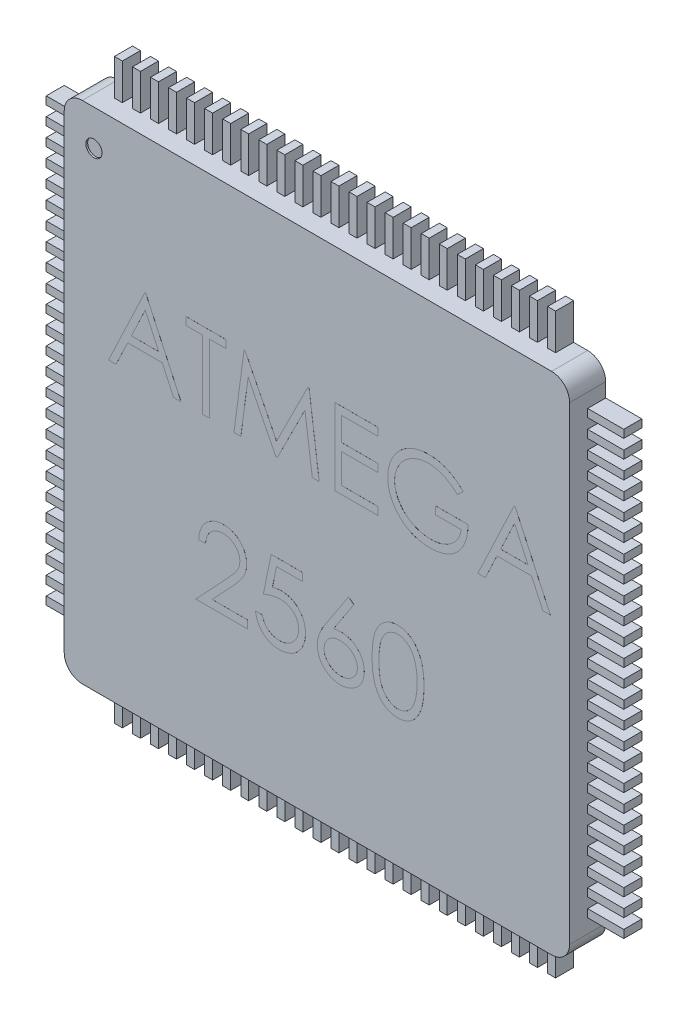
from build123d import *

# Parameters (mm, degrees)
BOSS_EXTRUDE1_DEPTH = 1
SKETCH3_W           = 1
SKETCH3_H           = 0.22
SKETCH3_W_2         = 0.22
SKETCH3_H_2         = 1
BOSS_EXTRUDE2_DEPTH = 0.5
BOSS_EXTRUDE3_DEPTH = 0.001
SKETCH5_R           = 0.223891774
CUT_EXTRUDE2_DEPTH  = 0.05


with BuildPart() as part:
    # Sketch1 → Boss-Extrude1 (new body)
    with BuildSketch(Plane.XY):
        with BuildLine():
            Line((6.5, 7), (-6.5, 7))
            ThreePointArc((-6.5, 7), (-6.853553391, 6.853553391), (-7, 6.5))
            Line((-7, 6.5), (-7, -6.5))
            ThreePointArc((-7, -6.5), (-6.853553391, -6.853553391), (-6.5, -7))
            Line((-6.5, -7), (6.5, -7))
            ThreePointArc((6.5, -7), (6.853553391, -6.853553391), (7, -6.5))
            Line((7, -6.5), (7, 6.5))
            ThreePointArc((7, 6.5), (6.853553391, 6.853553391), (6.5, 7))
        make_face()
    extrude(amount=BOSS_EXTRUDE1_DEPTH)

    # Sketch3 → Boss-Extrude2 (add)
    with BuildSketch(Plane.XY):
        with Locations((7.5, 0)):
            Rectangle(SKETCH3_W, SKETCH3_H)
        with Locations((7.5, 0.5)):
            Rectangle(SKETCH3_W, SKETCH3_H)
        with Locations((7.5, 1)):
            Rectangle(SKETCH3_W, SKETCH3_H)
        with Locations((7.5, 1.5)):
            Rectangle(SKETCH3_W, SKETCH3_H)
        with Locations((7.5, 2)):
            Rectangle(SKETCH3_W, SKETCH3_H)
        with Locations((7.5, 2.5)):
            Rectangle(SKETCH3_W, SKETCH3_H)
        with Locations((7.5, 3)):
            Rectangle(SKETCH3_W, SKETCH3_H)
        with Locations((7.5, 3.5)):
            Rectangle(SKETCH3_W, SKETCH3_H)
        with Locations((7.5, 4)):
            Rectangle(SKETCH3_W, SKETCH3_H)
        with Locations((7.5, 4.5)):
            Rectangle(SKETCH3_W, SKETCH3_H)
        with Locations((7.5, 5)):
            Rectangle(SKETCH3_W, SKETCH3_H)
        with Locations((7.5, 5.5)):
            Rectangle(SKETCH3_W, SKETCH3_H)
        with Locations((7.5, 6)):
            Rectangle(SKETCH3_W, SKETCH3_H)
        with Locations((7.5, -6)):
            Rectangle(SKETCH3_W, SKETCH3_H)
        with Locations((7.5, -5.5)):
            Rectangle(SKETCH3_W, SKETCH3_H)
        with Locations((7.5, -5)):
            Rectangle(SKETCH3_W, SKETCH3_H)
        with Locations((7.5, -4.5)):
            Rectangle(SKETCH3_W, SKETCH3_H)
        with Locations((7.5, -4)):
            Rectangle(SKETCH3_W, SKETCH3_H)
        with Locations((7.5, -3.5)):
            Rectangle(SKETCH3_W, SKETCH3_H)
        with Locations((7.5, -3)):
            Rectangle(SKETCH3_W, SKETCH3_H)
        with Locations((7.5, -2.5)):
            Rectangle(SKETCH3_W, SKETCH3_H)
        with Locations((7.5, -2)):
            Rectangle(SKETCH3_W, SKETCH3_H)
        with Locations((7.5, -1.5)):
            Rectangle(SKETCH3_W, SKETCH3_H)
        with Locations((7.5, -1)):
            Rectangle(SKETCH3_W, SKETCH3_H)
        with Locations((7.5, -0.5)):
            Rectangle(SKETCH3_W, SKETCH3_H)
        with Locations((-7.5, -0.5)):
            Rectangle(SKETCH3_W, SKETCH3_H)
        with Locations((-7.5, -1)):
            Rectangle(SKETCH3_W, SKETCH3_H)
        with Locations((-7.5, -1.5)):
            Rectangle(SKETCH3_W, SKETCH3_H)
        with Locations((-7.5, -2)):
            Rectangle(SKETCH3_W, SKETCH3_H)
        with Locations((-7.5, -2.5)):
            Rectangle(SKETCH3_W, SKETCH3_H)
        with Locations((-7.5, -3)):
            Rectangle(SKETCH3_W, SKETCH3_H)
        with Locations((-7.5, -3.5)):
            Rectangle(SKETCH3_W, SKETCH3_H)
        with Locations((-7.5, -4)):
            Rectangle(SKETCH3_W, SKETCH3_H)
        with Locations((-7.5, -4.5)):
            Rectangle(SKETCH3_W, SKETCH3_H)
        with Locations((-7.5, -5)):
            Rectangle(SKETCH3_W, SKETCH3_H)
        with Locations((-7.5, -5.5)):
            Rectangle(SKETCH3_W, SKETCH3_H)
        with Locations((-7.5, -6)):
            Rectangle(SKETCH3_W, SKETCH3_H)
        with Locations((-7.5, 6)):
            Rectangle(SKETCH3_W, SKETCH3_H)
        with Locations((-7.5, 5.5)):
            Rectangle(SKETCH3_W, SKETCH3_H)
        with Locations((-7.5, 5)):
            Rectangle(SKETCH3_W, SKETCH3_H)
        with Locations((-7.5, 4.5)):
            Rectangle(SKETCH3_W, SKETCH3_H)
        with Locations((-7.5, 4)):
            Rectangle(SKETCH3_W, SKETCH3_H)
        with Locations((-7.5, 3.5)):
            Rectangle(SKETCH3_W, SKETCH3_H)
        with Locations((-7.5, 3)):
            Rectangle(SKETCH3_W, SKETCH3_H)
        with Locations((-7.5, 2.5)):
            Rectangle(SKETCH3_W, SKETCH3_H)
        with Locations((-7.5, 2)):
            Rectangle(SKETCH3_W, SKETCH3_H)
        with Locations((-7.5, 1.5)):
            Rectangle(SKETCH3_W, SKETCH3_H)
        with Locations((-7.5, 1)):
            Rectangle(SKETCH3_W, SKETCH3_H)
        with Locations((-7.5, 0.5)):
            Rectangle(SKETCH3_W, SKETCH3_H)
        with Locations((-7.5, 0)):
            Rectangle(SKETCH3_W, SKETCH3_H)
        with Locations((0, 7.5)):
            Rectangle(SKETCH3_W_2, SKETCH3_H_2)
        with Locations((-0.5, 7.5)):
            Rectangle(SKETCH3_W_2, SKETCH3_H_2)
        with Locations((-1, 7.5)):
            Rectangle(SKETCH3_W_2, SKETCH3_H_2)
        with Locations((-1.5, 7.5)):
            Rectangle(SKETCH3_W_2, SKETCH3_H_2)
        with Locations((-2, 7.5)):
            Rectangle(SKETCH3_W_2, SKETCH3_H_2)
        with Locations((-2.5, 7.5)):
            Rectangle(SKETCH3_W_2, SKETCH3_H_2)
        with Locations((-3, 7.5)):
            Rectangle(SKETCH3_W_2, SKETCH3_H_2)
        with Locations((-3.5, 7.5)):
            Rectangle(SKETCH3_W_2, SKETCH3_H_2)
        with Locations((-4, 7.5)):
            Rectangle(SKETCH3_W_2, SKETCH3_H_2)
        with Locations((-4.5, 7.5)):
            Rectangle(SKETCH3_W_2, SKETCH3_H_2)
        with Locations((-5, 7.5)):
            Rectangle(SKETCH3_W_2, SKETCH3_H_2)
        with Locations((-5.5, 7.5)):
            Rectangle(SKETCH3_W_2, SKETCH3_H_2)
        with Locations((-6, 7.5)):
            Rectangle(SKETCH3_W_2, SKETCH3_H_2)
        with Locations((6, 7.5)):
            Rectangle(SKETCH3_W_2, SKETCH3_H_2)
        with Locations((5.5, 7.5)):
            Rectangle(SKETCH3_W_2, SKETCH3_H_2)
        with Locations((5, 7.5)):
            Rectangle(SKETCH3_W_2, SKETCH3_H_2)
        with Locations((4.5, 7.5)):
            Rectangle(SKETCH3_W_2, SKETCH3_H_2)
        with Locations((4, 7.5)):
            Rectangle(SKETCH3_W_2, SKETCH3_H_2)
        with Locations((3.5, 7.5)):
            Rectangle(SKETCH3_W_2, SKETCH3_H_2)
        with Locations((3, 7.5)):
            Rectangle(SKETCH3_W_2, SKETCH3_H_2)
        with Locations((2.5, 7.5)):
            Rectangle(SKETCH3_W_2, SKETCH3_H_2)
        with Locations((2, 7.5)):
            Rectangle(SKETCH3_W_2, SKETCH3_H_2)
        with Locations((1.5, 7.5)):
            Rectangle(SKETCH3_W_2, SKETCH3_H_2)
        with Locations((1, 7.5)):
            Rectangle(SKETCH3_W_2, SKETCH3_H_2)
        with Locations((0.5, 7.5)):
            Rectangle(SKETCH3_W_2, SKETCH3_H_2)
        with Locations((0.5, -7.5)):
            Rectangle(SKETCH3_W_2, SKETCH3_H_2)
        with Locations((1, -7.5)):
            Rectangle(SKETCH3_W_2, SKETCH3_H_2)
        with Locations((1.5, -7.5)):
            Rectangle(SKETCH3_W_2, SKETCH3_H_2)
        with Locations((2, -7.5)):
            Rectangle(SKETCH3_W_2, SKETCH3_H_2)
        with Locations((2.5, -7.5)):
            Rectangle(SKETCH3_W_2, SKETCH3_H_2)
        with Locations((3, -7.5)):
            Rectangle(SKETCH3_W_2, SKETCH3_H_2)
        with Locations((3.5, -7.5)):
            Rectangle(SKETCH3_W_2, SKETCH3_H_2)
        with Locations((4, -7.5)):
            Rectangle(SKETCH3_W_2, SKETCH3_H_2)
        with Locations((4.5, -7.5)):
            Rectangle(SKETCH3_W_2, SKETCH3_H_2)
        with Locations((5, -7.5)):
            Rectangle(SKETCH3_W_2, SKETCH3_H_2)
        with Locations((5.5, -7.5)):
            Rectangle(SKETCH3_W_2, SKETCH3_H_2)
        with Locations((6, -7.5)):
            Rectangle(SKETCH3_W_2, SKETCH3_H_2)
        with Locations((-6, -7.5)):
            Rectangle(SKETCH3_W_2, SKETCH3_H_2)
        with Locations((-5.5, -7.5)):
            Rectangle(SKETCH3_W_2, SKETCH3_H_2)
        with Locations((-5, -7.5)):
            Rectangle(SKETCH3_W_2, SKETCH3_H_2)
        with Locations((-4.5, -7.5)):
            Rectangle(SKETCH3_W_2, SKETCH3_H_2)
        with Locations((-4, -7.5)):
            Rectangle(SKETCH3_W_2, SKETCH3_H_2)
        with Locations((-3.5, -7.5)):
            Rectangle(SKETCH3_W_2, SKETCH3_H_2)
        with Locations((-3, -7.5)):
            Rectangle(SKETCH3_W_2, SKETCH3_H_2)
        with Locations((-2.5, -7.5)):
            Rectangle(SKETCH3_W_2, SKETCH3_H_2)
        with Locations((-2, -7.5)):
            Rectangle(SKETCH3_W_2, SKETCH3_H_2)
        with Locations((-1.5, -7.5)):
            Rectangle(SKETCH3_W_2, SKETCH3_H_2)
        with Locations((-1, -7.5)):
            Rectangle(SKETCH3_W_2, SKETCH3_H_2)
        with Locations((-0.5, -7.5)):
            Rectangle(SKETCH3_W_2, SKETCH3_H_2)
        with Locations((0, -7.5)):
            Rectangle(SKETCH3_W_2, SKETCH3_H_2)
    extrude(amount=BOSS_EXTRUDE2_DEPTH)

    # Sketch4 → Boss-Extrude3 (add)
    # profile 1 of 10: a face of its own
    with BuildSketch(Plane.XY.offset(1)):
        Polygon((-4.739964178, 3.253080773), (-3.763041101, 1.136414106), (-3.969534824, 1.136414106), (-4.282455497, 1.81483291), (-5.241994092, 1.81483291), (-5.563819012, 1.136414106), (-5.771160759, 1.136414106), (-4.76710093, 3.253080773), align=None)
        Polygon((-4.755652613, 2.840517338), (-5.138959237, 2.031926927), (-4.382522271, 2.031926927), align=None, mode=Mode.SUBTRACT)
    # profile 2 of 10: a face of its own
    with BuildSketch(Plane.XY.offset(1)):
        Polygon((-3.62735734, 3.035986756), (-3.62735734, 3.253080773), (-2.514750503, 3.253080773), (-2.514750503, 3.035986756), (-2.976075289, 3.035986756), (-2.976075289, 1.136414106), (-3.166032554, 1.136414106), (-3.166032554, 3.035986756), align=None)
    # profile 3 of 10: a face of its own
    with BuildSketch(Plane.XY.offset(1)):
        Polygon((-2.297656485, 1.136414106), (-2.018232741, 3.253080773), (-1.991095989, 3.253080773), (-1.117207768, 1.516328636), (-0.245439605, 3.253080773), (-0.217878841, 3.253080773), (0.06324095, 1.136414106), (-0.127564338, 1.136414106), (-0.330241956, 2.65946432), (-1.094311133, 1.136414106), (-1.13713632, 1.136414106), (-1.904173579, 2.662856414), (-2.106427185, 1.136414106), align=None)
    # profile 4 of 10: a face of its own
    with BuildSketch(Plane.XY.offset(1)):
        Polygon((0.497428985, 3.253080773), (1.691446079, 3.253080773), (1.691446079, 3.035986756), (0.68738625, 3.035986756), (0.68738625, 2.384704705), (1.691446079, 2.384704705), (1.691446079, 2.167610688), (0.68738625, 2.167610688), (0.68738625, 1.353508123), (1.691446079, 1.353508123), (1.691446079, 1.136414106), (0.497428985, 1.136414106), align=None)
    # profile 5 of 10: a face of its own
    with BuildSketch(Plane.XY.offset(1)):
        with BuildLine():
            Line((4.052343515, 2.89182276), (3.889523002, 2.737482482))
            add(Edge.make_bspline(
                [(3.889523002, 2.737482482), (3.860059674, 2.765199242), (3.801835589, 2.81997184), (3.706912014, 2.891038014), (3.607874006, 2.951917036), (3.505238353, 3.001450808), (3.401546752, 3.040973668), (3.298175539, 3.069112114), (3.196185044, 3.087056935), (3.128350583, 3.089202853), (3.094924978, 3.09026026)],
                knots=[0, 0, 0, 0, 1.08915593, 2.152340314, 3.188132944, 4.216796309, 5.218260357, 6.173443236, 7.099959455, 8, 8, 8, 8], degree=3))
            add(Edge.make_bspline(
                [(3.094924978, 3.09026026), (3.07441466, 3.090010127), (3.033447217, 3.08951051), (2.972594898, 3.08313377), (2.912380789, 3.073962638), (2.852918558, 3.060693026), (2.79409259, 3.043875166), (2.736107479, 3.022838243), (2.678855059, 2.998311977), (2.62287462, 2.969971338), (2.568602982, 2.938838288), (2.517345277, 2.904337504), (2.468774793, 2.867574759), (2.42380444, 2.827629643), (2.382175541, 2.784863986), (2.34289724, 2.74007332), (2.307350971, 2.692033926), (2.275243457, 2.641629667), (2.246600954, 2.589745819), (2.221316673, 2.536881773), (2.200091292, 2.48321287), (2.183297383, 2.428671766), (2.169441892, 2.37368041), (2.159694577, 2.317858031), (2.154199274, 2.261144859), (2.153248721, 2.22316747), (2.152770865, 2.204075698)],
                knots=[0, 0, 0, 0, 1.02818874, 2.053710826, 3.065248034, 4.081641283, 5.106893873, 6.131558223, 7.173050175, 8.228653731, 9.27666206, 10.308777013, 11.325269123, 12.329503258, 13.32196095, 14.316845687, 15.314881793, 16.315733098, 17.311955233, 18.285320748, 19.252783886, 20.203351036, 21.145449891, 22.095197417, 23.042428769, 24, 24, 24, 24], degree=3))
            add(Edge.make_bspline(
                [(2.152770865, 2.204075698), (2.153227895, 2.184559537), (2.154140706, 2.145580508), (2.159982899, 2.087405997), (2.170825216, 2.030095492), (2.185319973, 1.973460669), (2.203451228, 1.917404533), (2.226052793, 1.86217011), (2.252822942, 1.807759445), (2.283808857, 1.754662791), (2.317788132, 1.702941725), (2.35585371, 1.654222395), (2.396288444, 1.607856039), (2.440565421, 1.564872125), (2.487264859, 1.524120911), (2.537781997, 1.486725143), (2.591123485, 1.451964503), (2.647370704, 1.420277084), (2.705913339, 1.391969065), (2.765940042, 1.366796519), (2.827642578, 1.346065681), (2.890696681, 1.32916978), (2.955027183, 1.315320553), (3.020960626, 1.30641091), (3.088012216, 1.299945503), (3.133211293, 1.299472778), (3.155982671, 1.299234619)],
                knots=[0, 0, 0, 0, 0.93586088, 1.869166235, 2.799637598, 3.729985548, 4.670839027, 5.622275134, 6.589130586, 7.576015415, 8.568469353, 9.55398029, 10.53834874, 11.515998671, 12.510579167, 13.508179873, 14.527009472, 15.561807829, 16.601455013, 17.643573243, 18.680854198, 19.719860599, 20.772568776, 21.833555941, 22.908541556, 24, 24, 24, 24], degree=3))
            add(Edge.make_bspline(
                [(3.155982671, 1.299234619), (3.183425766, 1.299808282), (3.237314743, 1.300934762), (3.316530354, 1.309703985), (3.392611259, 1.323399903), (3.465343677, 1.343457374), (3.534812084, 1.369041025), (3.601271149, 1.399881092), (3.664197628, 1.437160466), (3.72378069, 1.47923609), (3.778667179, 1.526114108), (3.828169435, 1.576699088), (3.871497897, 1.63074549), (3.909298358, 1.68793499), (3.940569783, 1.74874096), (3.966237568, 1.812865415), (3.985912464, 1.880337196), (3.993989044, 1.926959278), (3.99807001, 1.95051667)],
                knots=[0, 0, 0, 0, 1.13008108, 2.219097802, 3.278683437, 4.311054135, 5.322181354, 6.324827112, 7.324222904, 8.330512327, 9.32562643, 10.293043162, 11.24128371, 12.174520618, 13.111833804, 14.052305215, 15.015860969, 16, 16, 16, 16], degree=3))
            Line((3.99807001, 1.95051667), (3.292514455, 1.95051667))
            Line((3.292514455, 1.95051667), (3.292514455, 2.167610688))
            Line((3.292514455, 2.167610688), (4.188027275, 2.167610688))
            add(Edge.make_bspline(
                [(4.188027275, 2.167610688), (4.186995643, 2.127147587), (4.184976553, 2.04795399), (4.170813685, 1.932462446), (4.147943699, 1.823380517), (4.11670151, 1.720593326), (4.076257888, 1.624246534), (4.027046883, 1.53424232), (3.968280886, 1.451162137), (3.902053143, 1.374327739), (3.82772793, 1.305790549), (3.747313574, 1.245552672), (3.660677217, 1.194811567), (3.56790081, 1.153530119), (3.469288071, 1.121312036), (3.364610813, 1.098469225), (3.254010988, 1.084783486), (3.178212141, 1.083034889), (3.139446212, 1.082140602)],
                knots=[0, 0, 0, 0, 1.140356446, 2.231883559, 3.274166699, 4.278491846, 5.25512956, 6.21435461, 7.1637429, 8.11826594, 9.068280886, 10.0076534, 10.945064095, 11.891975133, 12.864533718, 13.863980011, 14.907571808, 16, 16, 16, 16], degree=3))
            add(Edge.make_bspline(
                [(3.139446212, 1.082140602), (3.115551987, 1.082484785), (3.068424875, 1.083163624), (2.998822266, 1.08798802), (2.931138753, 1.095414845), (2.865384195, 1.106630229), (2.801316722, 1.120367187), (2.739256306, 1.137957726), (2.678966538, 1.158319273), (2.620354233, 1.181479037), (2.563951388, 1.208313325), (2.50950678, 1.238133916), (2.456719456, 1.270787044), (2.40594899, 1.306837413), (2.356930847, 1.346015377), (2.309981098, 1.388399461), (2.264836905, 1.433860091), (2.236557958, 1.466141682), (2.222308792, 1.482407696)],
                knots=[0, 0, 0, 0, 1.107784379, 2.184907829, 3.233506516, 4.263428166, 5.276301166, 6.270063455, 7.25232949, 8.225834625, 9.190232166, 10.146266622, 11.1027726, 12.066435141, 13.031522626, 14.010570082, 14.99756817, 16, 16, 16, 16], degree=3))
            add(Edge.make_bspline(
                [(2.222308792, 1.482407696), (2.201634443, 1.508213281), (2.160628917, 1.559396106), (2.107846413, 1.641401787), (2.062851279, 1.726311483), (2.02634312, 1.814361568), (1.997835801, 1.905469682), (1.977391067, 1.999519406), (1.965412373, 2.096631849), (1.963686662, 2.162348462), (1.9628136, 2.195595463)],
                knots=[0, 0, 0, 0, 1.023165419, 2.029347347, 3.013907458, 3.994755782, 4.975994455, 5.96558838, 6.970761222, 8, 8, 8, 8], degree=3))
            add(Edge.make_bspline(
                [(1.9628136, 2.195595463), (1.963135477, 2.220491245), (1.963775141, 2.269966397), (1.971531525, 2.34341915), (1.982660001, 2.415567664), (1.99901703, 2.486352962), (2.019637152, 2.55582232), (2.045371879, 2.624007993), (2.075334745, 2.69095022), (2.110160259, 2.756188226), (2.148916099, 2.818856323), (2.190977422, 2.878702233), (2.236941504, 2.934636096), (2.286057726, 2.987366283), (2.338912096, 3.036230348), (2.395009462, 3.081680691), (2.454393055, 3.12377828), (2.517249697, 3.161860037), (2.582641202, 3.19606756), (2.650410822, 3.226057226), (2.72053787, 3.250842374), (2.792496963, 3.271872231), (2.866832785, 3.287423768), (2.943005896, 3.298701819), (3.021413344, 3.306418944), (3.074412276, 3.307039584), (3.101285155, 3.307354277)],
                knots=[0, 0, 0, 0, 1.008945113, 2.00506715, 2.99143336, 3.967273523, 4.948097931, 5.927297278, 6.919902385, 7.919676788, 8.923139349, 9.905703106, 10.883022732, 11.856032218, 12.825136022, 13.798837087, 14.781400844, 15.773989409, 16.776158564, 17.77167057, 18.775803737, 19.789618931, 20.80898985, 21.851988756, 22.910860228, 24, 24, 24, 24], degree=3))
            add(Edge.make_bspline(
                [(3.101285155, 3.307354277), (3.123200664, 3.307003823), (3.166656543, 3.306308913), (3.231321153, 3.301492197), (3.294986262, 3.293857754), (3.357746269, 3.28343965), (3.419387452, 3.269249704), (3.480085412, 3.252269027), (3.539928137, 3.232498258), (3.598728078, 3.208919289), (3.656880601, 3.182156383), (3.714709048, 3.152031123), (3.77201583, 3.118028382), (3.828900328, 3.080047196), (3.885721252, 3.038739891), (3.941579869, 2.99292505), (3.997824506, 2.944409383), (4.033990365, 2.909525396), (4.052343515, 2.89182276)],
                knots=[0, 0, 0, 0, 0.985871117, 1.954866573, 2.915460327, 3.869826059, 4.81536089, 5.759505086, 6.70452669, 7.649098992, 8.607881297, 9.583363685, 10.581137262, 11.603961102, 12.659522466, 13.73993555, 14.853081303, 16, 16, 16, 16], degree=3))
        make_face()
    # profile 6 of 10: a face of its own
    with BuildSketch(Plane.XY.offset(1)):
        Polygon((5.490591378, 3.253080773), (6.467514455, 1.136414106), (6.261020731, 1.136414106), (5.948100058, 1.81483291), (4.988561463, 1.81483291), (4.666736543, 1.136414106), (4.459394797, 1.136414106), (5.463454626, 3.253080773), align=None)
        Polygon((5.474902943, 2.840517338), (5.091596319, 2.031926927), (5.848033285, 2.031926927), align=None, mode=Mode.SUBTRACT)
    # profile 7 of 10: a face of its own
    with BuildSketch(Plane.XY.offset(1)):
        with BuildLine():
            Line((-3.084622297, -1.925979056), (-3.274579562, -1.925979056))
            add(Edge.make_bspline(
                [(-3.274579562, -1.925979056), (-3.273341522, -1.900778091), (-3.270910044, -1.851284065), (-3.259523412, -1.779121512), (-3.243230596, -1.710145515), (-3.220194336, -1.6449099), (-3.191585301, -1.58283786), (-3.157277142, -1.524175945), (-3.116640861, -1.469147941), (-3.070553931, -1.418263974), (-3.020498611, -1.371583871), (-2.966489781, -1.33127332), (-2.909735884, -1.297214538), (-2.850409104, -1.268741596), (-2.787840097, -1.247369404), (-2.722596654, -1.231511555), (-2.654392129, -1.221970622), (-2.607922211, -1.220945075), (-2.58428843, -1.220423501)],
                knots=[0, 0, 0, 0, 1.10065271, 2.161652631, 3.183658789, 4.190468796, 5.17591951, 6.163126047, 7.15150782, 8.156236427, 9.156009102, 10.134482811, 11.092018607, 12.041330605, 13.001268258, 13.972401359, 14.968799086, 16, 16, 16, 16], degree=3))
            add(Edge.make_bspline(
                [(-2.58428843, -1.220423501), (-2.561078833, -1.220966853), (-2.515472803, -1.22203452), (-2.44891149, -1.231203333), (-2.385546174, -1.245563763), (-2.325500715, -1.265711657), (-2.26925419, -1.292795573), (-2.216384063, -1.325330275), (-2.166260906, -1.362958459), (-2.121141566, -1.407259574), (-2.079710489, -1.454553397), (-2.043967697, -1.505043701), (-2.013358784, -1.557191888), (-1.987845282, -1.61139561), (-1.969063712, -1.668165232), (-1.95480451, -1.726674254), (-1.946744598, -1.787528307), (-1.945507604, -1.828716557), (-1.944878708, -1.849656941)],
                knots=[0, 0, 0, 0, 1.111607364, 2.184268762, 3.212621178, 4.221274766, 5.211760367, 6.196651075, 7.1921475, 8.207485113, 9.220403448, 10.201281604, 11.166441695, 12.114753415, 13.065576456, 14.026450734, 14.996634279, 16, 16, 16, 16], degree=3))
            add(Edge.make_bspline(
                [(-1.944878708, -1.849656941), (-1.945902729, -1.879137774), (-1.9479328, -1.937582094), (-1.965298161, -2.023467273), (-1.992419623, -2.106678531), (-2.025075167, -2.173648233), (-2.058018026, -2.22761325), (-2.087704281, -2.272044324), (-2.122456809, -2.319884298), (-2.162781425, -2.370972973), (-2.207843971, -2.425710521), (-2.258052613, -2.484063873), (-2.313765385, -2.545430134), (-2.352868383, -2.587343521), (-2.373130577, -2.609061989)],
                knots=[0, 0, 0, 0, 1.184426356, 2.348067706, 3.509069118, 4.696110526, 5.333549288, 6.050745305, 6.844228056, 7.710549037, 8.667450064, 9.695053472, 10.805634456, 12, 12, 12, 12], degree=3))
            Line((-2.373130577, -2.609061989), (-2.902721256, -3.174269654))
            Line((-2.902721256, -3.174269654), (-1.917741956, -3.174269654))
            Line((-1.917741956, -3.174269654), (-1.917741956, -3.391363671))
            Line((-1.917741956, -3.391363671), (-3.355989819, -3.391363671))
            Line((-3.355989819, -3.391363671), (-2.535103067, -2.515355392))
            add(Edge.make_bspline(
                [(-2.535103067, -2.515355392), (-2.515116964, -2.49449213), (-2.47672775, -2.454418074), (-2.422430668, -2.395911617), (-2.37366328, -2.341634514), (-2.330109904, -2.291689316), (-2.292715356, -2.245345463), (-2.25953072, -2.204103904), (-2.232942006, -2.166152403), (-2.204085552, -2.122161651), (-2.176137097, -2.068451345), (-2.152120577, -2.002814304), (-2.137476359, -1.935245918), (-2.135719625, -1.889585162), (-2.134835973, -1.866617411)],
                knots=[0, 0, 0, 0, 1.329631726, 2.553950428, 3.673215718, 4.687767853, 5.603093632, 6.413772471, 7.123043292, 7.734684054, 8.834405432, 9.900288307, 10.943827018, 12, 12, 12, 12], degree=3))
            add(Edge.make_bspline(
                [(-2.134835973, -1.866617411), (-2.135220445, -1.852174851), (-2.135978167, -1.823711338), (-2.142665441, -1.781979284), (-2.152771319, -1.741723421), (-2.167252499, -1.702819922), (-2.186367051, -1.665659933), (-2.209634286, -1.630198219), (-2.236479705, -1.595914892), (-2.267534996, -1.563769802), (-2.301650535, -1.534329264), (-2.337690867, -1.50824946), (-2.375821168, -1.486454378), (-2.41588067, -1.468587597), (-2.457757692, -1.454572009), (-2.501533228, -1.444860392), (-2.547086324, -1.43876289), (-2.578191343, -1.437937891), (-2.5940407, -1.437517518)],
                knots=[0, 0, 0, 0, 0.991446411, 1.95395049, 2.89581595, 3.838931463, 4.798493298, 5.75982156, 6.748411868, 7.785213223, 8.824556874, 9.840280684, 10.836137867, 11.835679398, 12.848801643, 13.863922112, 14.911575587, 16, 16, 16, 16], degree=3))
            add(Edge.make_bspline(
                [(-2.5940407, -1.437517518), (-2.610593537, -1.437949942), (-2.643100576, -1.438799152), (-2.6908278, -1.444739525), (-2.736357771, -1.454987723), (-2.779805017, -1.469004093), (-2.821243052, -1.486819501), (-2.860470355, -1.509009271), (-2.897398864, -1.535487859), (-2.932098, -1.565508577), (-2.96406812, -1.598932317), (-2.992157421, -1.636191675), (-3.016701087, -1.67660635), (-3.038115243, -1.720067293), (-3.055505588, -1.766968864), (-3.068794113, -1.817144572), (-3.079309015, -1.87037655), (-3.082821787, -1.907137054), (-3.084622297, -1.925979056)],
                knots=[0, 0, 0, 0, 1.031018746, 2.02475058, 2.990194455, 3.934040569, 4.864654155, 5.795059489, 6.735614925, 7.690564532, 8.649604399, 9.611025574, 10.590972636, 11.591080095, 12.624614302, 13.701020113, 14.821632451, 16, 16, 16, 16], degree=3))
        make_face()
    # profile 8 of 10: a face of its own
    with BuildSketch(Plane.XY.offset(1)):
        with BuildLine():
            Line((-0.398083836, -1.274697005), (-0.398083836, -1.491791022))
            Line((-0.398083836, -1.491791022), (-1.118055791, -1.491791022))
            Line((-1.118055791, -1.491791022), (-1.232114952, -2.048518452))
            add(Edge.make_bspline(
                [(-1.232114952, -2.048518452), (-1.209704971, -2.042331574), (-1.166289177, -2.030345475), (-1.10220869, -2.017037223), (-1.041374357, -2.009014788), (-1.0018983, -2.007919376), (-0.982796042, -2.007389312)],
                knots=[0, 0, 0, 0, 1.100273476, 2.13160584, 3.095893838, 4, 4, 4, 4], degree=3))
            add(Edge.make_bspline(
                [(-0.982796042, -2.007389312), (-0.959159685, -2.007900902), (-0.912684702, -2.008906815), (-0.84468591, -2.018565981), (-0.779775065, -2.033769644), (-0.718087918, -2.055009198), (-0.659510347, -2.082168893), (-0.604581297, -2.116096), (-0.552476274, -2.155728062), (-0.504130039, -2.201293855), (-0.4602701, -2.25144169), (-0.421706858, -2.305360974), (-0.388951387, -2.362527703), (-0.362607502, -2.423488071), (-0.341571262, -2.487568131), (-0.327569817, -2.555442121), (-0.318246379, -2.62647027), (-0.317204745, -2.675035415), (-0.316673579, -2.699800504)],
                knots=[0, 0, 0, 0, 1.052922333, 2.070308379, 3.05430497, 4.020497103, 4.973039431, 5.925935799, 6.892292201, 7.88610001, 8.88166317, 9.857072816, 10.836096531, 11.812156883, 12.81219415, 13.836441305, 14.89672472, 16, 16, 16, 16], degree=3))
            add(Edge.make_bspline(
                [(-0.316673579, -2.699800504), (-0.317075792, -2.717049656), (-0.31787478, -2.751314853), (-0.321937926, -2.80220206), (-0.329760955, -2.852011964), (-0.340264293, -2.900751173), (-0.353897088, -2.948327412), (-0.370400468, -2.99487686), (-0.390597114, -3.040109789), (-0.412750374, -3.084454194), (-0.437694672, -3.126907577), (-0.46537977, -3.166609583), (-0.494629376, -3.204155792), (-0.526102024, -3.239143525), (-0.560090245, -3.271342874), (-0.596182415, -3.30094493), (-0.634090536, -3.328450306), (-0.674401087, -3.3527425), (-0.716215827, -3.375096288), (-0.760138606, -3.393434808), (-0.805169601, -3.409830223), (-0.85195693, -3.422898842), (-0.900394617, -3.433139006), (-0.950562505, -3.440094131), (-1.002197481, -3.445159881), (-1.037198084, -3.445476992), (-1.05487804, -3.445637176)],
                knots=[0, 0, 0, 0, 1.056347294, 2.098418968, 3.122841568, 4.141288669, 5.149314143, 6.15115421, 7.162517403, 8.180376062, 9.185164535, 10.17417709, 11.141909838, 12.097768115, 13.052685741, 14.0056014, 14.954263652, 15.917497458, 16.885230207, 17.854509472, 18.828990115, 19.81800267, 20.826176721, 21.857883937, 22.917946725, 24, 24, 24, 24], degree=3))
            add(Edge.make_bspline(
                [(-1.05487804, -3.445637176), (-1.075968616, -3.445219383), (-1.117461833, -3.444397426), (-1.178252842, -3.435798628), (-1.236742151, -3.423483307), (-1.292458927, -3.404955658), (-1.345902501, -3.381740484), (-1.396353382, -3.352399752), (-1.445100685, -3.319150485), (-1.490162726, -3.279913319), (-1.531985709, -3.237026216), (-1.569424407, -3.190485166), (-1.602767094, -3.141058313), (-1.631479827, -3.08850562), (-1.655971487, -3.032965175), (-1.67521198, -2.974228884), (-1.690741271, -2.912603644), (-1.697311054, -2.870177473), (-1.700647938, -2.848628629)],
                knots=[0, 0, 0, 0, 1.0467383, 2.05933395, 3.04377827, 4.011590433, 4.970194871, 5.932262533, 6.905835911, 7.896367577, 8.894135286, 9.877477877, 10.858688626, 11.851381753, 12.8477658, 13.868841284, 14.917554742, 16, 16, 16, 16], degree=3))
            Line((-1.700647938, -2.848628629), (-1.510690673, -2.848628629))
            add(Edge.make_bspline(
                [(-1.510690673, -2.848628629), (-1.506016736, -2.868813436), (-1.49703317, -2.907609755), (-1.477314455, -2.962117757), (-1.453205092, -3.010691764), (-1.424536748, -3.053974321), (-1.390337444, -3.091716905), (-1.351312504, -3.125351986), (-1.307559357, -3.155695992), (-1.258940594, -3.180988809), (-1.207648875, -3.202559912), (-1.153965848, -3.216924032), (-1.099353219, -3.227024096), (-1.062415348, -3.228035113), (-1.043853734, -3.228543159)],
                knots=[0, 0, 0, 0, 1.136247022, 2.183929868, 3.172523383, 4.106158343, 5.02341133, 5.958108904, 6.928429099, 7.938127109, 8.96079061, 9.975095812, 10.982467395, 12, 12, 12, 12], degree=3))
            add(Edge.make_bspline(
                [(-1.043853734, -3.228543159), (-1.025736008, -3.228046783), (-0.990062058, -3.227069417), (-0.937561838, -3.219546776), (-0.886875005, -3.207961007), (-0.838501699, -3.190622571), (-0.791595434, -3.169549812), (-0.747342725, -3.142507838), (-0.704463366, -3.111386779), (-0.664290162, -3.075732055), (-0.627496781, -3.036440859), (-0.594987126, -2.994423578), (-0.567907755, -2.949600533), (-0.545087603, -2.902747721), (-0.52775918, -2.853351641), (-0.515397253, -2.801643788), (-0.50813826, -2.747496443), (-0.50713969, -2.710564051), (-0.506630844, -2.69174428)],
                knots=[0, 0, 0, 0, 1.027316725, 2.022795036, 3.002884548, 3.971462791, 4.93288096, 5.914575861, 6.907176829, 7.935150275, 8.956128384, 9.956726525, 10.942570165, 11.921478529, 12.907843606, 13.90538589, 14.932640048, 16, 16, 16, 16], degree=3))
            add(Edge.make_bspline(
                [(-0.506630844, -2.69174428), (-0.507029068, -2.674765135), (-0.507808533, -2.641530875), (-0.514177021, -2.592908498), (-0.525254428, -2.54690242), (-0.540629822, -2.503290478), (-0.560151239, -2.462031539), (-0.584006866, -2.423083022), (-0.612644397, -2.386958275), (-0.64535711, -2.353640397), (-0.681194116, -2.322891354), (-0.720771998, -2.296678502), (-0.763262526, -2.274626514), (-0.80815376, -2.255595867), (-0.856513484, -2.241927797), (-0.907384019, -2.231666266), (-0.961314695, -2.225730309), (-0.998187444, -2.224906691), (-1.017140994, -2.22448333)],
                knots=[0, 0, 0, 0, 1.045622112, 2.046656509, 3.013763289, 3.955457236, 4.890082067, 5.820317437, 6.762574623, 7.722996705, 8.69280354, 9.665887285, 10.63943826, 11.638615906, 12.663482002, 13.728887084, 14.832589034, 16, 16, 16, 16], degree=3))
            add(Edge.make_bspline(
                [(-1.017140994, -2.22448333), (-1.033547537, -2.224834449), (-1.067422885, -2.225559421), (-1.119385737, -2.230897351), (-1.173990732, -2.239508733), (-1.231028546, -2.25135375), (-1.290670472, -2.266854448), (-1.352790648, -2.285429408), (-1.417519685, -2.307637474), (-1.461133737, -2.324408861), (-1.483553921, -2.333030338)],
                knots=[0, 0, 0, 0, 0.817624296, 1.688186739, 2.600797293, 3.572016777, 4.590301741, 5.671205678, 6.80286297, 8, 8, 8, 8], degree=3))
            Line((-1.483553921, -2.333030338), (-1.266459904, -1.274697005))
            Line((-1.266459904, -1.274697005), (-0.398083836, -1.274697005))
        make_face()
    # profile 9 of 10: a face of its own
    with BuildSketch(Plane.XY.offset(1)):
        with BuildLine():
            Line((0.877343515, -1.220423501), (1.023627569, -1.335330685))
            Line((1.023627569, -1.335330685), (0.464356068, -2.190562389))
            add(Edge.make_bspline(
                [(0.464356068, -2.190562389), (0.501591426, -2.18462734), (0.574223202, -2.173050356), (0.647741626, -2.171140551), (0.683570144, -2.170209825)],
                knots=[0, 0, 0, 0, 1.025318673, 2, 2, 2, 2], degree=3))
            add(Edge.make_bspline(
                [(0.683570144, -2.170209825), (0.705083034, -2.170788045), (0.74743052, -2.171926254), (0.809604157, -2.180685535), (0.869347942, -2.194489293), (0.92641425, -2.214611086), (0.981007911, -2.240314891), (1.033442217, -2.271120779), (1.082731528, -2.308619452), (1.129510574, -2.350508259), (1.171981248, -2.396903769), (1.209582957, -2.446132196), (1.241167732, -2.498142253), (1.266793865, -2.552907596), (1.286693482, -2.610343805), (1.301200296, -2.670377394), (1.309775574, -2.73304976), (1.310940037, -2.775672276), (1.311531549, -2.797323207)],
                knots=[0, 0, 0, 0, 1.04369286, 2.054478336, 3.041073146, 4.015093852, 4.984733326, 5.965804835, 6.960378782, 7.985147595, 9.009457201, 10.008161701, 10.986880575, 11.956520048, 12.937015923, 13.931873656, 14.949455224, 16, 16, 16, 16], degree=3))
            add(Edge.make_bspline(
                [(1.311531549, -2.797323207), (1.310670909, -2.826944266), (1.308977374, -2.8852315), (1.292102221, -2.970125984), (1.26587996, -3.051002315), (1.228398312, -3.126569233), (1.181842299, -3.196723168), (1.125068707, -3.258883902), (1.060090979, -3.314322448), (0.986620391, -3.360681451), (0.907552027, -3.398541392), (0.824486772, -3.425734657), (0.738231307, -3.442476565), (0.679687568, -3.444575453), (0.650073215, -3.445637176)],
                knots=[0, 0, 0, 0, 1.031375318, 2.029502543, 3.004789286, 3.987476834, 4.960371455, 5.9300674, 6.912260825, 7.929083631, 8.949397511, 9.960523116, 10.96833055, 12, 12, 12, 12], degree=3))
            add(Edge.make_bspline(
                [(0.650073215, -3.445637176), (0.621590925, -3.444712975), (0.565172495, -3.442882296), (0.482179329, -3.426574324), (0.402433599, -3.400141933), (0.326494021, -3.363726631), (0.256147746, -3.317729721), (0.193212813, -3.262356343), (0.138003026, -3.198790142), (0.092056469, -3.12704098), (0.055614284, -3.04993991), (0.028285138, -2.969544582), (0.012321696, -2.886147927), (0.010090997, -2.829614095), (0.008967446, -2.801139312)],
                knots=[0, 0, 0, 0, 1.012016664, 2.004627821, 2.994792927, 3.992885782, 4.990978636, 5.973936114, 6.964471063, 7.975201453, 8.993600317, 9.990122807, 10.98767138, 12, 12, 12, 12], degree=3))
            add(Edge.make_bspline(
                [(0.008967446, -2.801139312), (0.009681939, -2.779340922), (0.011140797, -2.734832773), (0.021327038, -2.667423575), (0.037694795, -2.598449825), (0.056025277, -2.539936575), (0.075393146, -2.492002226), (0.091511587, -2.453355829), (0.111573956, -2.413586037), (0.132966429, -2.371329124), (0.157614631, -2.327674124), (0.184415047, -2.281891429), (0.214108646, -2.234709158), (0.234924649, -2.202690526), (0.245566004, -2.186322272)],
                knots=[0, 0, 0, 0, 1.173818275, 2.396712641, 3.66331629, 4.989737886, 5.693666774, 6.447286557, 7.243889047, 8.091586357, 8.998013824, 9.943181721, 10.948533338, 12, 12, 12, 12], degree=3))
            Line((0.245566004, -2.186322272), (0.877343515, -1.220423501))
        make_face()
        with BuildLine():
            add(Edge.make_bspline(
                [(0.643713039, -2.387303842), (0.627588729, -2.387774374), (0.596093268, -2.388693458), (0.549884974, -2.394030634), (0.506152674, -2.404081212), (0.464316979, -2.416881803), (0.425160035, -2.434482225), (0.388397261, -2.455861646), (0.353886491, -2.481032549), (0.3219892, -2.509638338), (0.29306969, -2.540957767), (0.268164911, -2.574503621), (0.246682316, -2.609467449), (0.229215692, -2.646141385), (0.215614551, -2.684511411), (0.205776133, -2.724401053), (0.200300769, -2.7660778), (0.199389858, -2.794339837), (0.198924711, -2.808771524)],
                knots=[0, 0, 0, 0, 1.129588631, 2.206414736, 3.251139165, 4.268635594, 5.265702196, 6.250456724, 7.242448911, 8.251968645, 9.246821453, 10.222880186, 11.173611482, 12.116736599, 13.062300278, 14.020270554, 14.989073742, 16, 16, 16, 16], degree=3))
            add(Edge.make_bspline(
                [(0.198924711, -2.808771524), (0.199303511, -2.823074131), (0.20004628, -2.851119414), (0.206790778, -2.892448346), (0.217092947, -2.932220457), (0.232417853, -2.97023071), (0.250697924, -3.007058483), (0.274831144, -3.041369823), (0.301571771, -3.075248627), (0.333535817, -3.106092374), (0.367839946, -3.134792332), (0.404489244, -3.159878009), (0.442685982, -3.181338695), (0.482945842, -3.198157788), (0.524697627, -3.211961047), (0.5682892, -3.221674418), (0.613750879, -3.227165974), (0.644546527, -3.228078072), (0.660249497, -3.228543159)],
                knots=[0, 0, 0, 0, 0.989467248, 1.94019797, 2.891935182, 3.827694429, 4.772920941, 5.730924762, 6.725747692, 7.756678648, 8.79901574, 9.819492441, 10.826891316, 11.826466727, 12.835195252, 13.867842842, 14.912794438, 16, 16, 16, 16], degree=3))
            add(Edge.make_bspline(
                [(0.660249497, -3.228543159), (0.675952442, -3.228078035), (0.70674804, -3.227165866), (0.752210085, -3.221674828), (0.795800306, -3.211959541), (0.837557004, -3.198163247), (0.877798726, -3.181318445), (0.915962058, -3.160011522), (0.952264762, -3.13463806), (0.986591411, -3.10614142), (1.018422411, -3.075073076), (1.045804385, -3.041672244), (1.069198531, -3.006781174), (1.088208729, -2.970375784), (1.103364844, -2.932197474), (1.113719255, -2.892454503), (1.120449825, -2.851117802), (1.121194508, -2.823073586), (1.121574284, -2.808771524)],
                knots=[0, 0, 0, 0, 1.087397944, 2.132534446, 3.165364764, 4.174271784, 5.174024072, 6.181601208, 7.194203697, 8.236725232, 9.267838612, 10.269026844, 11.221737037, 12.171628256, 13.107553087, 14.05945871, 15.010357665, 16, 16, 16, 16], degree=3))
            add(Edge.make_bspline(
                [(1.121574284, -2.808771524), (1.121241488, -2.79432101), (1.120588317, -2.76595935), (1.113200576, -2.724419695), (1.102954474, -2.684308737), (1.087482832, -2.645878568), (1.067382636, -2.609280841), (1.042899813, -2.574330682), (1.014577259, -2.540760139), (0.981861128, -2.509576917), (0.946246558, -2.48106416), (0.908379037, -2.455894238), (0.86876231, -2.43465199), (0.827436545, -2.416928171), (0.78392823, -2.404137775), (0.738939787, -2.394066528), (0.691895816, -2.388707117), (0.659978534, -2.387777558), (0.643713039, -2.387303842)],
                knots=[0, 0, 0, 0, 0.978206639, 1.919901502, 2.851605144, 3.780102724, 4.718870031, 5.675451981, 6.667674623, 7.690630536, 8.733308323, 9.756129687, 10.767539656, 11.776269907, 12.797430371, 13.836405707, 14.897401972, 16, 16, 16, 16], degree=3))
        make_face(mode=Mode.SUBTRACT)
    # profile 10 of 10: a face of its own
    with BuildSketch(Plane.XY.offset(1)):
        with BuildLine():
            add(Edge.make_bspline(
                [(1.528625566, -2.333878362), (1.528823939, -2.299952799), (1.529209281, -2.234051903), (1.533496088, -2.138025001), (1.540617366, -2.047939493), (1.550376635, -1.963791067), (1.562252937, -1.885558), (1.578107065, -1.813449361), (1.596136712, -1.747131408), (1.617032715, -1.686387884), (1.640611044, -1.630400416), (1.666273669, -1.578133747), (1.695039044, -1.529666959), (1.725263177, -1.484226486), (1.758169526, -1.442556156), (1.792821651, -1.404067498), (1.830572024, -1.369650044), (1.870137367, -1.338295376), (1.911875896, -1.310809267), (1.954597889, -1.286598991), (1.998597405, -1.265916214), (2.043994573, -1.249653903), (2.090381358, -1.236221629), (2.137919917, -1.227035932), (2.186688742, -1.221256278), (2.2196068, -1.220703727), (2.23630118, -1.220423501)],
                knots=[0, 0, 0, 0, 1.646270934, 3.197905019, 4.663502075, 6.030701355, 7.308322542, 8.50163776, 9.611534131, 10.641858119, 11.616356847, 12.558055219, 13.465016945, 14.349605745, 15.204443733, 16.039544428, 16.859896111, 17.680448484, 18.487036065, 19.28249412, 20.06191084, 20.843045899, 21.620316918, 22.403196591, 23.190181807, 24, 24, 24, 24], degree=3))
            add(Edge.make_bspline(
                [(2.23630118, -1.220423501), (2.253135017, -1.220718513), (2.286612223, -1.221305199), (2.336106164, -1.226943964), (2.384456686, -1.23630031), (2.431457655, -1.24955728), (2.477495147, -1.266004189), (2.52220907, -1.286618779), (2.565877162, -1.310615047), (2.607805479, -1.338811391), (2.648454317, -1.370248292), (2.686825228, -1.405785715), (2.722921704, -1.445064831), (2.75719677, -1.487665387), (2.788678012, -1.534404462), (2.818658135, -1.584469138), (2.845492652, -1.638734947), (2.871336956, -1.696296468), (2.8936448, -1.758746395), (2.913762958, -1.825732702), (2.930018334, -1.898046615), (2.943558513, -1.975308726), (2.954048045, -2.057802775), (2.961687786, -2.145351928), (2.965723414, -2.238013783), (2.966483419, -2.301367339), (2.966873429, -2.333878362)],
                knots=[0, 0, 0, 0, 0.810914788, 1.612654377, 2.396697861, 3.181598691, 3.963628158, 4.749916497, 5.551656086, 6.361998678, 7.18212741, 8.025565596, 8.878627764, 9.750805457, 10.657531673, 11.591944965, 12.560506719, 13.57287815, 14.630710178, 15.753379473, 16.941251878, 18.199788006, 19.531962791, 20.947069417, 22.433333509, 24, 24, 24, 24], degree=3))
            add(Edge.make_bspline(
                [(2.966873429, -2.333878362), (2.966479376, -2.366247582), (2.965711578, -2.429317688), (2.961733027, -2.521562611), (2.953896141, -2.608647142), (2.944092957, -2.690780136), (2.93051547, -2.767619744), (2.913820917, -2.839431863), (2.89528477, -2.906526611), (2.872403727, -2.96835433), (2.847360107, -3.025777515), (2.820112441, -3.079400029), (2.790920689, -3.129695834), (2.75911702, -3.176262348), (2.725218051, -3.21942944), (2.688498245, -3.258435145), (2.649992701, -3.294219314), (2.60922424, -3.326061012), (2.566642016, -3.353931347), (2.523123907, -3.378855913), (2.477897766, -3.398953781), (2.431988504, -3.416210687), (2.384739445, -3.42939477), (2.336209485, -3.438510863), (2.286645475, -3.444904314), (2.253140719, -3.445392043), (2.23630118, -3.445637176)],
                knots=[0, 0, 0, 0, 1.561518951, 3.042555995, 4.452378317, 5.7783523, 7.031515105, 8.214008947, 9.334062868, 10.386615937, 11.391082383, 12.354592575, 13.286541444, 14.194233754, 15.072674879, 15.931287219, 16.775624067, 17.606195743, 18.42308326, 19.229000347, 20.022332153, 20.807536673, 21.593273796, 22.3848459, 23.188221202, 24, 24, 24, 24], degree=3))
            add(Edge.make_bspline(
                [(2.23630118, -3.445637176), (2.219607264, -3.445355142), (2.186690119, -3.444799026), (2.137914604, -3.439045483), (2.090572365, -3.429795346), (2.044429785, -3.416843399), (1.99925013, -3.400989665), (1.955649043, -3.380334818), (1.913141729, -3.356547072), (1.871841598, -3.329456507), (1.832524719, -3.298419109), (1.794969849, -3.264090229), (1.760120432, -3.225613214), (1.727684574, -3.183595613), (1.696857388, -3.138423985), (1.668500481, -3.089481588), (1.642271441, -3.036962486), (1.618296568, -2.980527368), (1.597039995, -2.919352721), (1.578263524, -2.852738694), (1.563438295, -2.780097333), (1.550748603, -2.702012069), (1.540513381, -2.618147358), (1.533525766, -2.528457673), (1.52920697, -2.432998904), (1.528822904, -2.367521469), (1.528625566, -2.333878362)],
                knots=[0, 0, 0, 0, 0.810891512, 1.598919785, 2.382837074, 3.152667961, 3.926044502, 4.706494248, 5.493654104, 6.291793342, 7.103789334, 7.925228297, 8.761435821, 9.622817696, 10.50288917, 11.416980706, 12.369136599, 13.353924996, 14.394355917, 15.514179734, 16.714354668, 17.994756427, 19.357759367, 20.818452758, 22.365282078, 24, 24, 24, 24], degree=3))
        make_face()
        with BuildLine():
            add(Edge.make_bspline(
                [(1.718582831, -2.333030338), (1.718655068, -2.36130217), (1.718795266, -2.416172245), (1.722457825, -2.495906027), (1.727447251, -2.570273797), (1.733882702, -2.639369983), (1.743439724, -2.702960705), (1.754148114, -2.761483323), (1.767179578, -2.814628128), (1.782597994, -2.862759804), (1.800159733, -2.906695193), (1.819334232, -2.947577833), (1.839932859, -2.985890671), (1.862985869, -3.021289567), (1.888092598, -3.053889962), (1.91468595, -3.084268865), (1.943758418, -3.111360373), (1.983977348, -3.143852328), (2.037073311, -3.177428185), (2.103972348, -3.206666058), (2.172714697, -3.225040211), (2.219372834, -3.227376863), (2.242661356, -3.228543159)],
                knots=[0, 0, 0, 0, 1.459021318, 2.831673884, 4.118529203, 5.306027144, 6.411944654, 7.436330062, 8.375795394, 9.233974572, 10.042671642, 10.816086306, 11.563610507, 12.285937304, 12.993564865, 13.685989202, 14.367179055, 15.041617293, 16.353048772, 17.594441528, 18.799311195, 20, 20, 20, 20], degree=3))
            add(Edge.make_bspline(
                [(2.242661356, -3.228543159), (2.26610052, -3.227576882), (2.312930453, -3.225646323), (2.381349463, -3.20702042), (2.447770626, -3.178917412), (2.499823657, -3.145687254), (2.539425004, -3.114041074), (2.567798613, -3.087059835), (2.593840899, -3.056848429), (2.61854063, -3.024252188), (2.641194452, -2.988648353), (2.66179454, -2.950208128), (2.680592565, -2.908824768), (2.691302321, -2.87993545), (2.696777943, -2.865165087)],
                knots=[0, 0, 0, 0, 1.353760809, 2.704726607, 4.075137775, 5.516104923, 6.260822281, 7.007110065, 7.778089737, 8.566572457, 9.372053459, 10.217411131, 11.088608312, 12, 12, 12, 12], degree=3))
            add(Edge.make_bspline(
                [(2.696777943, -2.865165087), (2.70315925, -2.84627853), (2.71611604, -2.807930721), (2.73281459, -2.748444131), (2.745965379, -2.686031031), (2.757796557, -2.621064413), (2.765871977, -2.553065165), (2.772371845, -2.482243685), (2.776200403, -2.408546576), (2.77667499, -2.358475319), (2.776916164, -2.333030338)],
                knots=[0, 0, 0, 0, 0.884706709, 1.796334032, 2.740027952, 3.714592787, 4.726048262, 5.777819803, 6.87074269, 8, 8, 8, 8], degree=3))
            add(Edge.make_bspline(
                [(2.776916164, -2.333030338), (2.776583431, -2.307589473), (2.775932533, -2.257821702), (2.77344455, -2.184936897), (2.767019817, -2.115711156), (2.759884159, -2.049846251), (2.749362982, -1.987706782), (2.738018975, -1.92877255), (2.722778242, -1.873773673), (2.706498188, -1.821849069), (2.687865234, -1.773588673), (2.66735429, -1.728767479), (2.645448751, -1.687169098), (2.621656062, -1.648907661), (2.596258673, -1.61381179), (2.56858625, -1.582585155), (2.539736463, -1.55425994), (2.499327974, -1.521927815), (2.446426856, -1.488961219), (2.380601155, -1.458622878), (2.312099385, -1.44120072), (2.265790677, -1.438744367), (2.242661356, -1.437517518)],
                knots=[0, 0, 0, 0, 1.31362396, 2.569729283, 3.763502607, 4.902122613, 5.988968491, 7.01645872, 7.998833611, 8.933434873, 9.825090667, 10.667526885, 11.477055099, 12.250526234, 12.991942729, 13.710640831, 14.402115721, 15.076753259, 16.378508321, 17.609869233, 18.806226677, 20, 20, 20, 20], degree=3))
            add(Edge.make_bspline(
                [(2.242661356, -1.437517518), (2.219250665, -1.438746059), (2.172386634, -1.44120538), (2.10317287, -1.458557967), (2.036827858, -1.488803904), (1.98406663, -1.522037005), (1.943629959, -1.553689222), (1.91515614, -1.58113722), (1.888458217, -1.611161384), (1.863863941, -1.644061589), (1.840828994, -1.679419216), (1.81967381, -1.717512422), (1.800613329, -1.758534247), (1.78302411, -1.8024499), (1.767558662, -1.850577424), (1.754801837, -1.903656768), (1.743016809, -1.961993245), (1.734673956, -2.025928376), (1.727257304, -2.095041869), (1.722490965, -2.169595295), (1.718783014, -2.249462801), (1.718650895, -2.304616578), (1.718582831, -2.333030338)],
                knots=[0, 0, 0, 0, 1.207732386, 2.417664972, 3.655092373, 4.956220595, 5.625982001, 6.301752483, 6.994047911, 7.697131622, 8.419323945, 9.170223765, 9.943494443, 10.752040957, 11.610060368, 12.549350801, 13.567764191, 14.679664412, 15.874934091, 17.154273443, 18.533957287, 20, 20, 20, 20], degree=3))
        make_face(mode=Mode.SUBTRACT)
    extrude(amount=BOSS_EXTRUDE3_DEPTH)

    # Sketch5 → Cut-Extrude2 (cut)
    with BuildSketch(Plane.XY.offset(1)):
        with Locations((-6.177765452, 6.010255875)):
            Circle(SKETCH5_R)
    extrude(amount=-CUT_EXTRUDE2_DEPTH, mode=Mode.SUBTRACT)


solid = part.part
